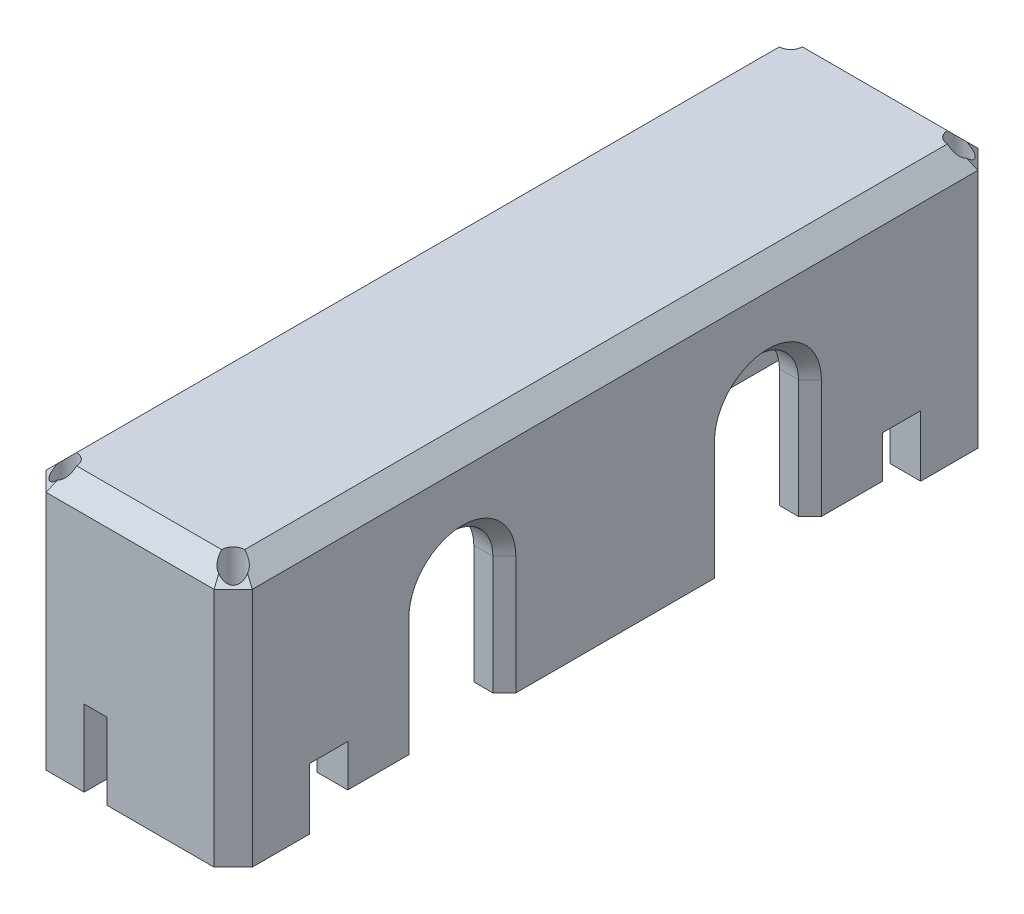
from build123d import *

# Parameters (mm, degrees)
SKETCH2_W               = 54
SKETCH2_H               = 200
SKETCH2_W_2             = 38
SKETCH2_H_2             = 184
BOSS_EXTRUDE2_DEPTH     = 55
CUT_EXTRUDE1_DEPTH      = 118.277448813
BOSS_EXTRUDE3_START     = 55
SKETCH5_W               = 54
SKETCH5_H               = 200
BOSS_EXTRUDE3_DEPTH     = 8
CUT_EXTRUDE2_DEPTH      = 122.235308388
CUT_EXTRUDE2_DEPTH_BACK = 122.235308388
SKETCH6_R               = 1.75
CUT_EXTRUDE3_START      = 63
SKETCH7_R               = 3
CUT_EXTRUDE3_DEPTH      = 44
CHAMFER1_SIZE           = 5
CHAMFER3_SIZE           = 5
CHAMFER4_SIZE           = 3
BOSS_EXTRUDE4_START     = -5
SKETCH8_R               = 1.75
BOSS_EXTRUDE4_DEPTH     = 5
CUT_EXTRUDE4_DEPTH      = 122.235308388
CUT_EXTRUDE4_DEPTH_BACK = 122.235308388
SKETCH9_W               = 6
SKETCH9_H               = 20
SKETCH10_W              = 10
SKETCH10_H              = 16
CUT_EXTRUDE5_DEPTH      = 122.235308388


with BuildPart() as part:
    # Sketch2 → Boss-Extrude2 (new body)
    with BuildSketch(Plane(origin=(0, 0, 0), x_dir=(1, 0, 0), z_dir=(0, 1, 0))):
        Rectangle(SKETCH2_W, SKETCH2_H)
        Rectangle(SKETCH2_W_2, SKETCH2_H_2, mode=Mode.SUBTRACT)
    extrude(amount=BOSS_EXTRUDE2_DEPTH)

    # Sketch3 → Cut-Extrude1 (cut, through all)
    with BuildSketch(Plane(origin=(0, 0, 0), x_dir=(0, 0, -1), z_dir=(1, 0, 0))):
        with BuildLine():
            Line((-51, 0), (-51, 31))
            ThreePointArc((-51, 31), (-40, 42), (-29, 31))
            Line((-29, 31), (-29, 0))
            Line((-29, 0), (-51, 0))
        make_face()
        with BuildLine():
            Line((51, 0), (51, 31))
            ThreePointArc((51, 31), (40, 42), (29, 31))
            Line((29, 31), (29, 0))
            Line((29, 0), (51, 0))
        make_face()
    extrude(amount=CUT_EXTRUDE1_DEPTH, mode=Mode.SUBTRACT)

    # Sketch5 → Boss-Extrude3 (add)
    with BuildSketch(Plane(origin=(0, 0, 0), x_dir=(1, 0, 0), z_dir=(0, 1, 0)).offset(BOSS_EXTRUDE3_START)):
        Rectangle(SKETCH5_W, SKETCH5_H)
    extrude(amount=BOSS_EXTRUDE3_DEPTH)

    # Sketch6 → Cut-Extrude2 (cut, two sides: drawn at the far end of the back side and taken through both)
    with BuildSketch(Plane(origin=(0, 0, 0), x_dir=(1, 0, 0), z_dir=(0, 1, 0)).offset(-CUT_EXTRUDE2_DEPTH_BACK)):
        with Locations(Location((22, -95, 0), (0, 0, 270))):
            Circle(SKETCH6_R)
        with Locations(Location((-22, -95, 0), (0, 0, 270))):
            Circle(SKETCH6_R)
        with Locations(Location((-22, 95, 0), (0, 0, 270))):
            Circle(SKETCH6_R)
        with Locations(Location((22, 95, 0), (0, 0, 270))):
            Circle(SKETCH6_R)
    extrude(amount=CUT_EXTRUDE2_DEPTH + CUT_EXTRUDE2_DEPTH_BACK, mode=Mode.SUBTRACT)

    # Sketch7 → Cut-Extrude3 (cut)
    with BuildSketch(Plane(origin=(0, 0, 0), x_dir=(1, 0, 0), z_dir=(0, 1, 0)).offset(CUT_EXTRUDE3_START)):
        with Locations(Location((-22, -95, 0), (0, 0, 90))):
            Circle(SKETCH7_R)
        with Locations(Location((-22, 95, 0), (0, 0, 90))):
            Circle(SKETCH7_R)
        with Locations(Location((22, 95, 0), (0, 0, 90))):
            Circle(SKETCH7_R)
        with Locations(Location((22, -95, 0), (0, 0, 90))):
            Circle(SKETCH7_R)
    extrude(amount=-CUT_EXTRUDE3_DEPTH, mode=Mode.SUBTRACT)

    # Chamfer1
    chamfer1_edges = [part.edges().sort_by_distance(p)[0] for p in [
        (-27, 31.5, -100),
        (27, 31.5, -100),
        (27, 31.5, 100),
        (-27, 31.5, 100),
    ]]
    chamfer(chamfer1_edges, length=CHAMFER1_SIZE)

    # Chamfer3
    # the kernel refuses this chamfer: 5 mm, written as the material it takes off along each edge
    with BuildSketch(Plane(origin=(-34.85841494, 63, 100), x_dir=(0, -0.9996219169112968, 0.0274958766105877), z_dir=(1, 0, 0))) as chamfer3_piece_1:
        Polygon((CHAMFER3_SIZE * 0.999621916911, CHAMFER3_SIZE * 0.0274958766106), (-CHAMFER3_SIZE * 0.0274958766106, CHAMFER3_SIZE * 0.999621916911), (0, 0), align=None)
    extrude(amount=69.71682988, mode=Mode.SUBTRACT)
    with BuildSketch(Plane(origin=(-27, 63, -107.85841494), x_dir=(0.9996219169112968, 0.027495876610586317, 0), z_dir=(0, 0, 1)), Plane(origin=(27, 63, 107.85841494), x_dir=(-0.9996219169112968, 0.027495876610586317, 0), z_dir=(0, 0, -1))) as chamfer3_piece_2:
        Polygon((CHAMFER3_SIZE * 0.999621916911, -CHAMFER3_SIZE * 0.0274958766106), (-CHAMFER3_SIZE * 0.0274958766106, -CHAMFER3_SIZE * 0.999621916911), (0, 0), align=None)
    extrude(amount=215.71682988, mode=Mode.SUBTRACT)
    with BuildSketch(Plane(origin=(34.85841494, 63, -100), x_dir=(0, 0.027495876610586282, 0.9996219169112968), z_dir=(-1, 0, 0))) as chamfer3_piece_3:
        Polygon((CHAMFER3_SIZE * 0.999621916911, -CHAMFER3_SIZE * 0.0274958766106), (-CHAMFER3_SIZE * 0.0274958766106, -CHAMFER3_SIZE * 0.999621916911), (0, 0), align=None)
    extrude(amount=69.71682988, mode=Mode.SUBTRACT)
    with BuildSketch(Plane(origin=(12.907727601, 63, 109.092272399), x_dir=(-0.7068394360706735, 0.027495876610586337, -0.7068394360706735), z_dir=(0.7071067811865476, 0, -0.7071067811865476)), Plane(origin=(36.092272399, 63, -85.907727601), x_dir=(-0.7068394360706735, 0.027495876610586334, 0.7068394360706735), z_dir=(-0.7071067811865476, 0, -0.7071067811865476))) as chamfer3_piece_4:
        Polygon((CHAMFER3_SIZE * 0.999621916911, -CHAMFER3_SIZE * 0.0274958766106), (-CHAMFER3_SIZE * 0.0274958766106, -CHAMFER3_SIZE * 0.999621916911), (0, 0), align=None)
    extrude(amount=32.787897692, mode=Mode.SUBTRACT)
    with BuildSketch(Plane(origin=(-36.092272399, 63, -85.907727601), x_dir=(0.7068394360706735, 0.027495876610586334, 0.7068394360706735), z_dir=(0.7071067811865476, 0, -0.7071067811865476)), Plane(origin=(-12.907727601, 63, 109.092272399), x_dir=(0.7068394360706735, 0.027495876610586337, -0.7068394360706735), z_dir=(-0.7071067811865476, 0, -0.7071067811865476))) as chamfer3_piece_5:
        Polygon((CHAMFER3_SIZE * 0.999621916911, CHAMFER3_SIZE * 0.0274958766106), (-CHAMFER3_SIZE * 0.0274958766106, CHAMFER3_SIZE * 0.999621916911), (0, 0), align=None)
    extrude(amount=32.787897692, mode=Mode.SUBTRACT)

    # Chamfer4
    chamfer4_edges = [part.edges().sort_by_distance(p)[0] for p in [
        (27, 15.5, 29),
        (27, 42, 40),
        (27, 15.5, 51),
        (27, 15.5, -51),
        (27, 42, -40),
        (27, 15.5, -29),
    ]]
    chamfer(chamfer4_edges, length=CHAMFER4_SIZE)

    # Sketch8 → Boss-Extrude4 (add)
    # profile 1 of 2: a face of its own
    with BuildSketch(Plane(origin=(0, 0, 0), x_dir=(1, 0, 0), z_dir=(0, 1, 0)).offset(BOSS_EXTRUDE4_START)):
        Polygon((27, -70), (19, -70), (19, -92), (-19, -92), (-19, -70), (-27, -70), (-27, -95), (-22, -100), (22, -100), (27, -95), align=None)
        with Locations(Location((22, -95, 0), (0, 0, 90))):
            Circle(SKETCH8_R, mode=Mode.SUBTRACT)
        with Locations(Location((-22, -95, 0), (0, 0, 90))):
            Circle(SKETCH8_R, mode=Mode.SUBTRACT)
    # profile 2 of 2: a face of its own
    with BuildSketch(Plane(origin=(0, 0, 0), x_dir=(1, 0, 0), z_dir=(0, 1, 0)).offset(BOSS_EXTRUDE4_START)):
        Polygon((27, 95), (27, 70), (19, 70), (19, 92), (-19, 92), (-19, 70), (-27, 70), (-27, 95), (-22, 100), (22, 100), align=None)
        with Locations(Location((-22, 95, 0), (0, 0, 90))):
            Circle(SKETCH8_R, mode=Mode.SUBTRACT)
        with Locations(Location((22, 95, 0), (0, 0, 90))):
            Circle(SKETCH8_R, mode=Mode.SUBTRACT)
    extrude(amount=BOSS_EXTRUDE4_DEPTH)

    # Sketch9 → Cut-Extrude4 (cut, two sides: drawn at the far end of the back side and taken through both)
    with BuildSketch(Plane.XY.offset(-CUT_EXTRUDE4_DEPTH_BACK)):
        with Locations((-9, 5)):
            Rectangle(SKETCH9_W, SKETCH9_H)
    extrude(amount=CUT_EXTRUDE4_DEPTH + CUT_EXTRUDE4_DEPTH_BACK, mode=Mode.SUBTRACT)

    # Sketch10 → Cut-Extrude5 (cut, through all)
    with BuildSketch(Plane(origin=(0, 0, 0), x_dir=(0, 0, -1), z_dir=(1, 0, 0))):
        with Locations((-75, 3)):
            Rectangle(SKETCH10_W, SKETCH10_H)
        with Locations((75, 3)):
            Rectangle(SKETCH10_W, SKETCH10_H)
    extrude(amount=CUT_EXTRUDE5_DEPTH, mode=Mode.SUBTRACT)


solid = part.part
